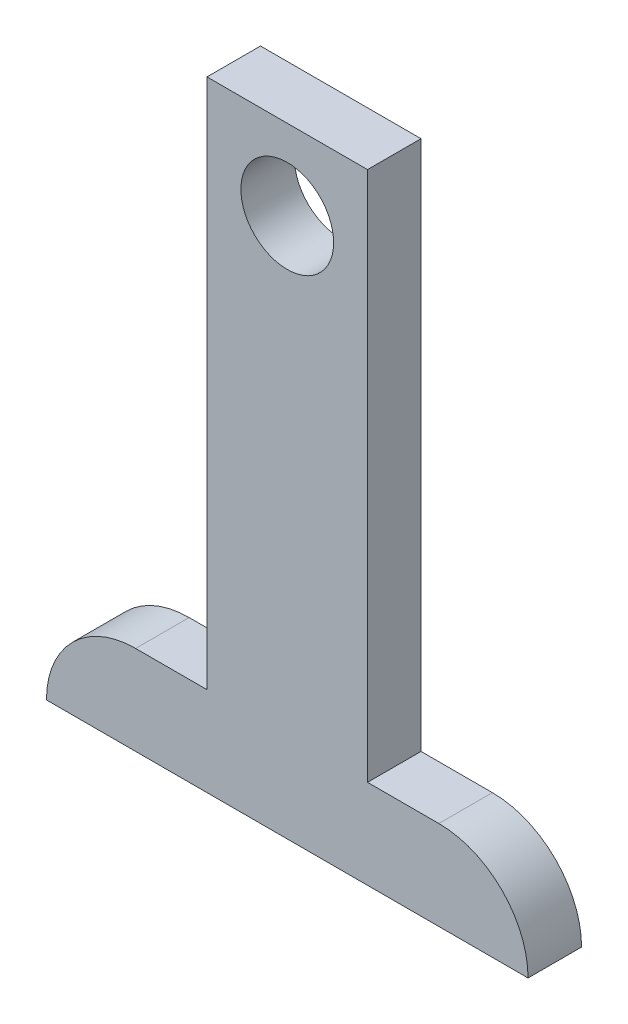
from build123d import *

# Parameters (mm, degrees)
ESQUISSE1_R        = 2.6
BOSS_EXTRU_1_DEPTH = 3
CONG_1_R           = 5
CONG_2_R           = 5


with BuildPart() as part:
    # Esquisse1 → Boss.-Extru.1 (new body)
    with BuildSketch(Plane.XY):
        Polygon((-9, 0), (-18, 0), (-18, -5), (9, -5), (9, 0), (0, 0), (0, 29.75), (-9, 29.75), align=None)
        with Locations((-4.5, 25.25)):
            Circle(ESQUISSE1_R, mode=Mode.SUBTRACT)
    extrude(amount=BOSS_EXTRU_1_DEPTH)

    # Congé1
    cong_1_edges = [part.edges().sort_by_distance(p)[0] for p in [
        (-18, 0, 1.5),
    ]]
    fillet(cong_1_edges, radius=CONG_1_R - 0.0001)  # a hair under: the kernel refuses the full size

    # Congé2
    cong_2_edges = [part.edges().sort_by_distance(p)[0] for p in [
        (9, 0, 1.5),
    ]]
    fillet(cong_2_edges, radius=CONG_2_R - 0.0001)  # a hair under: the kernel refuses the full size


solid = part.part
